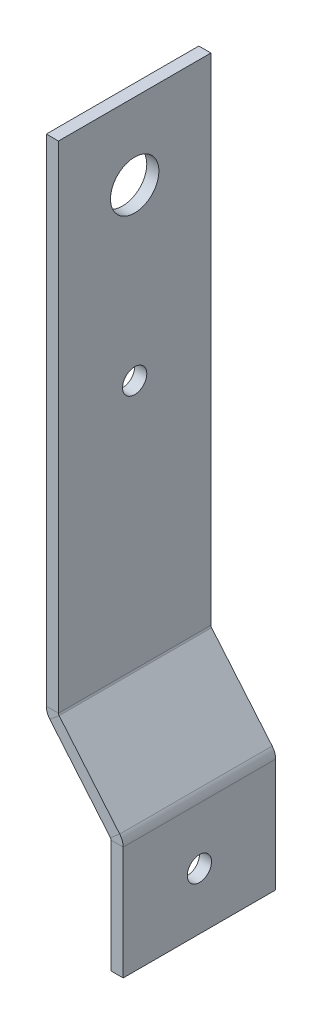
from build123d import *

# Parameters (mm, degrees)
SKETCH1_W          = 40
SKETCH1_H          = 130
SKETCH1_R          = 6.35
SKETCH1_R_2        = 3.175
BASE_FLANGE1_DEPTH = 3.175
EDGE_FLANGE1_DEPTH = 40
EDGE_FLANGE2_DEPTH = 40
SKETCH20_R         = 3.175
CUT_EXTRUDE3_DEPTH = 3.175


# Sheet-metal steps are written as plain solids
with BuildPart() as part:
    # Sketch1 → Base-Flange1 (new body)
    with BuildSketch(Plane(origin=(0, 0, 0), x_dir=(0, 0, -1), z_dir=(1, 0, 0))):
        with Locations((20, -65)):
            Rectangle(SKETCH1_W, SKETCH1_H)
        with Locations((20, -20)):
            Circle(SKETCH1_R, mode=Mode.SUBTRACT)
        with Locations((20, -64.45)):
            Circle(SKETCH1_R_2, mode=Mode.SUBTRACT)
    extrude(amount=-BASE_FLANGE1_DEPTH)

    # Edge-Flange1 section (across the edge) → Edge-Flange1 (add)
    with BuildSketch(Plane(origin=(0, -130.268100475, 0), x_dir=(0.7660444431189817, 0.642787609686535, 0), z_dir=(0, 0, -1))):
        with BuildLine():
            Line((-3.175, 0.268100475), (-3.175, 25))
            Line((-3.175, 25), (0, 25))
            Line((0, 25), (0, 0.268100475))
            ThreePointArc((0, 0.268100475), (0.044422416, 0.016168437), (0.172331663, -0.205376879))
            Line((0.172331663, -0.205376879), (-2.259859444, -2.246227539))
            ThreePointArc((-2.259859444, -2.246227539), (-2.939101655, -1.069745518), (-3.175, 0.268100475))
        make_face()
    extrude(amount=EDGE_FLANGE1_DEPTH)

    # Edge-Flange2 section (across the edge) → Edge-Flange2 (add)
    with BuildSketch(Plane(origin=(13.809830798, -151.665439092, -40), x_dir=(-1, 0, 0), z_dir=(0, 0, 1))):
        with BuildLine():
            Line((-3.175, 0.268100475), (-3.175, 30))
            Line((-3.175, 30), (0, 30))
            Line((0, 30), (0, 0.268100475))
            ThreePointArc((0, 0.268100475), (0.044422416, 0.016168437), (0.172331663, -0.205376879))
            Line((0.172331663, -0.205376879), (-2.259859444, -2.246227539))
            ThreePointArc((-2.259859444, -2.246227539), (-2.939101655, -1.069745518), (-3.175, 0.268100475))
        make_face()
    extrude(amount=EDGE_FLANGE2_DEPTH)

    # Sketch20 → Cut-Extrude3 (cut)
    with BuildSketch(Plane(origin=(16.984830798, 0, 0), x_dir=(0, 0, -1), z_dir=(1, 0, 0))):
        with Locations(Location((20, -166.799489329, 0), (0, 0, 90))):
            Circle(SKETCH20_R)
    extrude(amount=-CUT_EXTRUDE3_DEPTH, mode=Mode.SUBTRACT)


solid = part.part
